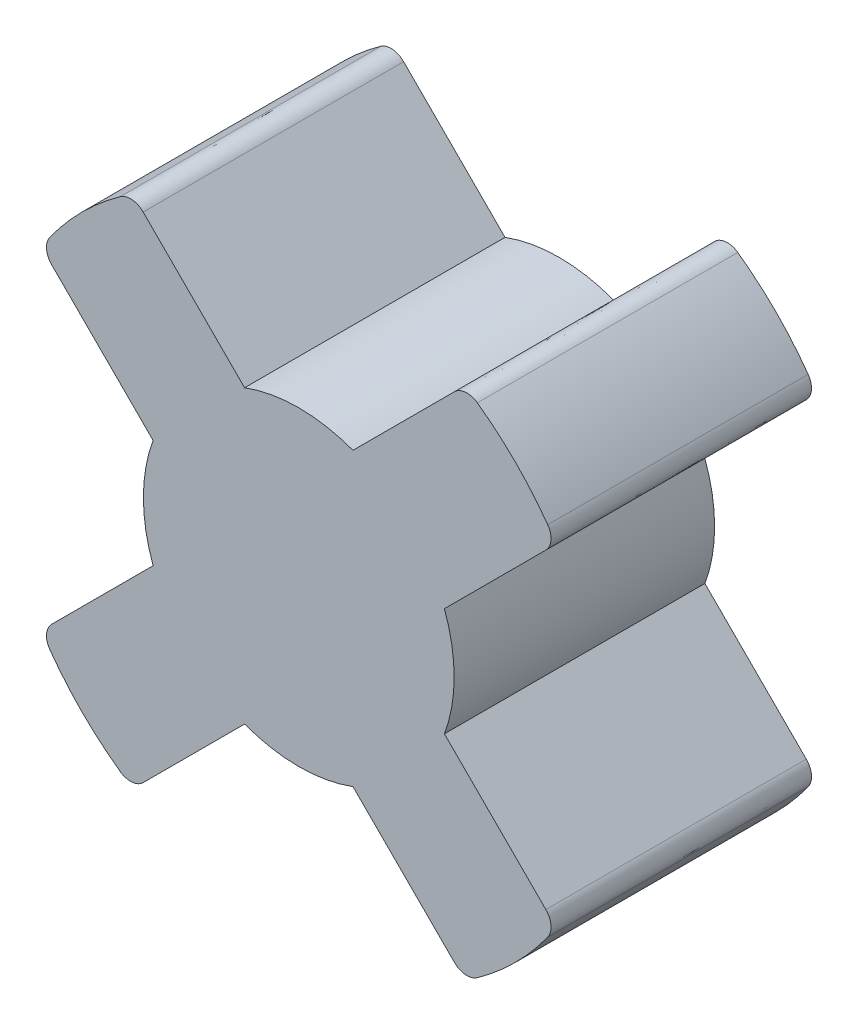
from build123d import *

# Parameters (mm, degrees)
BOSS_EXTRUDE1_DEPTH = 14.63
FILLET1_R           = 1


with BuildPart() as part:
    # Sketch1 → Boss-Extrude1 (new body)
    with BuildSketch(Plane.XY):
        with BuildLine():
            Line((-8.519586833, 13.656293319), (-9.325754445, 14.46246093))
            ThreePointArc((-9.325754445, 14.46246093), (-12.168247041, 12.168247045), (-14.462460931, 9.325754452))
            Line((-14.462460931, 9.325754452), (-11.8745961, 6.737889618))
            Line((-11.874596103, 6.737889615), (-10.218772523, 5.082066036))
            Line((-10.218772523, 5.082066036), (-8.180331434, 3.043624946))
            ThreePointArc((-8.180331434, 3.043624946), (-8.7282, 0), (-8.18033144, -3.043624947))
            Line((-8.18033144, -3.043624947), (-10.218772531, -5.082066037))
            Line((-10.218772528, -5.082066035), (-13.656293332, -8.519586838))
            Line((-13.656293332, -8.519586838), (-14.462460943, -9.32575445))
            ThreePointArc((-14.462460943, -9.32575445), (-12.168247058, -12.168247046), (-9.325754465, -14.462460936))
            Line((-9.325754465, -14.462460936), (-8.519586857, -13.656293329))
            Line((-8.519586853, -13.656293332), (-5.082066058, -10.218772534))
            Line((-5.082066049, -10.218772528), (-3.043624959, -8.180331439))
            ThreePointArc((-3.043624959, -8.180331439), (-2.566843213, -8.342229394), (-2.081519018, -8.476364428))
            ThreePointArc((-2.081519021, -8.476364441), (-1e-08, -8.728200016), (2.081519001, -8.47636444))
            ThreePointArc((2.081518999, -8.476364431), (2.566843194, -8.342229397), (3.04362494, -8.180331443))
            Line((3.04362494, -8.180331443), (3.232471481, -8.369177985))
            Line((3.232471481, -8.369177985), (5.082066029, -10.218772535))
            Line((5.082066028, -10.21877254), (8.519586825, -13.656293337))
            Line((8.519586826, -13.656293336), (9.325754437, -14.462460949))
            ThreePointArc((9.325754437, -14.462460949), (12.168247033, -12.168247063), (14.462460923, -9.32575447))
            Line((14.462460923, -9.32575447), (13.656293316, -8.519586862))
            Line((13.656293316, -8.519586862), (10.218772514, -5.082066055))
            Line((10.218772514, -5.082066055), (8.180331425, -3.043624964))
            ThreePointArc((8.180331425, -3.043624964), (8.728199992, -1.8e-08), (8.180331432, 3.043624929))
            Line((8.180331432, 3.043624929), (10.218772523, 5.082066019))
            Line((10.218772523, 5.082066019), (13.656293323, 8.51958682))
            Line((13.656293323, 8.51958682), (14.462460935, 9.325754432))
            ThreePointArc((14.462460935, 9.325754432), (12.16824705, 12.168247028), (9.325754457, 14.462460918))
            Line((9.325754457, 14.462460918), (8.519586849, 13.65629331))
            Line((8.519586849, 13.65629331), (5.082066046, 10.218772512))
            Line((5.082066041, 10.21877251), (3.043624951, 8.18033142))
            ThreePointArc((3.043624951, 8.18033142), (5e-09, 8.728199987), (-3.043624942, 8.180331427))
            Line((-3.043624942, 8.180331427), (-3.232471485, 8.36917797))
            Line((-3.232471485, 8.36917797), (-5.082066032, 10.218772518))
            Line((-5.082066032, 10.218772518), (-8.519586833, 13.656293319))
        make_face()
    extrude(amount=BOSS_EXTRUDE1_DEPTH)

    # Fillet1
    fillet1_edges = [part.edges().sort_by_distance(p)[0] for p in [
        (14.462460923, -9.32575447, 7.315),
        (9.325754437, -14.462460949, 7.315),
        (-9.325754465, -14.462460936, 7.315),
        (-14.462460943, -9.32575445, 7.315),
        (-14.462460931, 9.325754452, 7.315),
        (-9.325754445, 14.46246093, 7.315),
        (9.325754457, 14.462460918, 7.315),
        (14.462460935, 9.325754432, 7.315),
    ]]
    fillet(fillet1_edges, radius=FILLET1_R)


solid = part.part
